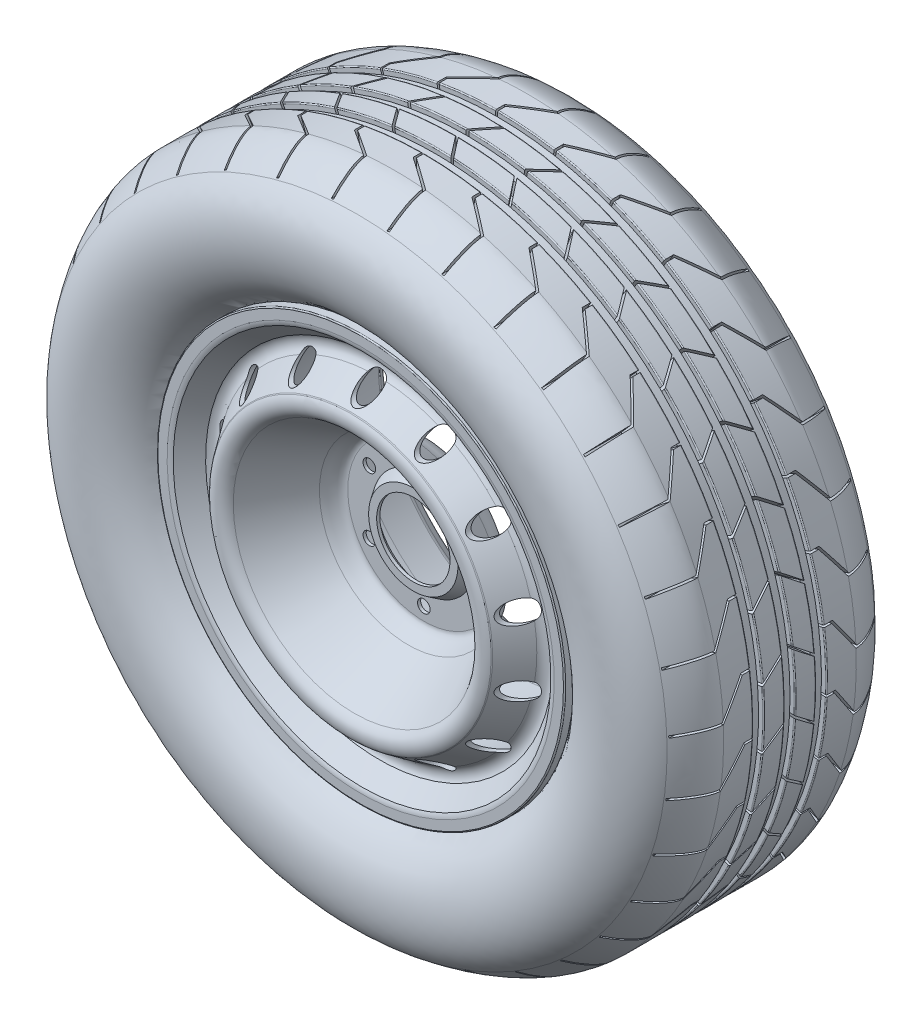
from build123d import *

# Parameters (mm, degrees)
SKETCH4_R          = 10
CUT_EXTRUDE1_DEPTH = 280
SKETCH5_R          = 6
CUT_EXTRUDE2_DEPTH = 308.751546457
SKETCH8_W          = 10
SKETCH8_H          = 5
FILLET1_R          = 1
CUT_EXTRUDE3_DEPTH = 25
CIRPATTERN1_COUNT  = 35


with BuildPart() as part:
    # Sketch3 → Revolve2 (revolve)
    with BuildSketch(Plane(origin=(0, 0, 0), x_dir=(0, 0, -1), z_dir=(1, 0, 0))):
        with BuildLine():
            Line((-205.976672895, 132.545710763), (-168.32873816, 158.905030976))
            Line((-168.32873816, 158.905030976), (-50.533527528, 160.605115441))
            Line((-50.533527528, 160.605115441), (-19.67682352, 162.242109346))
            ThreePointArc((-19.67682352, 162.242109346), (-17.988866809, 162.681997), (-16.502942556, 163.595631567))
            Line((-16.502942556, 163.595631567), (-8.613282192, 169.732034072))
            ThreePointArc((-8.613282192, 169.732034072), (-7.23504651, 171.163590491), (-6.367288364, 172.951293815))
            Line((-6.367288364, 172.951293815), (-3.257166694, 181.724352935))
            ThreePointArc((-3.257166694, 181.724352935), (-2.62535832, 183.407484304), (-2.478866017, 185.199313826))
            Line((-2.478866017, 185.199313826), (-2.478866017, 190.02316213))
            ThreePointArc((-2.478866017, 190.02316213), (-3.464560288, 194.56121075), (-8.002608909, 193.575516479))
            Line((-8.002608909, 193.575516479), (-15.84871123, 193.575516479))
            ThreePointArc((-15.84871123, 193.575516479), (-16.347620773, 193.357623724), (-16.565513529, 192.85871418))
            Line((-16.565513529, 192.85871418), (-16.565513529, 188.096364254))
            ThreePointArc((-16.565513529, 188.096364254), (-16.672768644, 187.147180592), (-17.066683828, 186.276959866))
            Line((-17.066683828, 186.276959866), (-21.032277405, 177.690694143))
            ThreePointArc((-21.032277405, 177.690694143), (-21.913333431, 176.327612765), (-23.041277725, 175.160568535))
            Line((-23.041277725, 175.160568535), (-29.905978286, 169.821356987))
            ThreePointArc((-29.905978286, 169.821356987), (-31.406523464, 168.93888179), (-33.134571829, 168.728531716))
            Line((-33.134571829, 168.728531716), (-60.542176562, 168.728531716))
            Line((-60.542176562, 168.728531716), (-164.636430634, 169.644050138))
            ThreePointArc((-164.636430634, 169.644050138), (-171.313601612, 170.559422201), (-177.229613663, 173.787938839))
            Line((-177.229613663, 173.787938839), (-180.613912, 175.971696747))
            Line((-180.613912, 175.971696747), (-187.299183614, 184.567045965))
            ThreePointArc((-187.299183614, 184.567045965), (-188.500602287, 186.514981874), (-188.97748407, 188.753384183))
            Line((-188.97748407, 188.753384183), (-188.97748407, 193.511188152))
            ThreePointArc((-188.97748407, 193.511188152), (-189.293281495, 194.175237477), (-189.95733082, 194.491034901))
            Line((-189.95733082, 194.491034901), (-197.443763886, 194.491034901))
            ThreePointArc((-197.443763886, 194.491034901), (-198.190119131, 194.145301882), (-198.53585215, 193.398946637))
            Line((-198.53585215, 193.398946637), (-198.53585215, 184.567045965))
            ThreePointArc((-198.53585215, 184.567045965), (-198.147923782, 182.240346175), (-197.247657756, 180.060084398))
            Line((-197.247657756, 180.060084398), (-180.613912, 165.772511518))
            ThreePointArc((-180.613912, 165.772511518), (-178.993638023, 158.574272361), (-182.937855027, 152.338641924))
            Line((-182.937855027, 152.338641924), (-207.697312521, 135.00322969))
            Line((-207.697312521, 135.00322969), (-208.408674764, 134.302232015))
            ThreePointArc((-208.408674764, 134.302232015), (-210.599766045, 124.053775031), (-204.517883943, 115.518995499))
            Line((-204.517883943, 115.518995499), (-153.01247642, 84.869794829))
            add(Edge.make_bspline(
                [(-153.01247642, 84.869794829), (-151.064119062, 83.710390438), (-144.265476161, 80.542437664), (-138.325, 76.29074716), (-138.325, 72.5)],
                knots=[0, 0, 0, 0, 0.479312715, 1, 1, 1, 1], degree=3))
            Line((-138.325, 72.5), (-138.325, 49.128999377))
            Line((-138.325, 49.128999377), (-148.325, 42.635891688))
            Line((-148.325, 42.635891688), (-148.325, 35))
            Line((-148.325, 35), (-145.325, 35))
            Line((-145.325, 35), (-145.325, 41.006892311))
            Line((-145.325, 41.006892311), (-135.325, 47.5))
            Line((-135.325, 47.5), (-135.325, 72.5))
            add(Edge.make_bspline(
                [(-154.188885966, 89.060819209), (-147.180223198, 84.890190882), (-141.057590791, 83.97066154), (-135.325, 76.308231088), (-135.325, 72.5)],
                knots=[0, 0, 0, 0, 0.64050498, 1, 1, 1, 1], degree=3))
            Line((-154.188885966, 89.060819209), (-202.98375688, 118.097067288))
            ThreePointArc((-202.98375688, 118.097067288), (-207.662127727, 124.662282313), (-205.976672895, 132.545710763))
        make_face()
    revolve(axis=Axis((0, 0, -0.000166179), (0, 0, 1)))

    # Sketch4 → Cut-Extrude1 (cut)
    with BuildSketch(Plane.XY.offset(258.53585215)):
        with Locations(Location((0, 147, 0), (0, 0, 269.999999996))):
            Circle(SKETCH4_R)
        with Locations(Location((63.78090965, 132.442423582, 0), (0, 0, 4.919230637))):
            Circle(SKETCH4_R)
        with Locations(Location((114.929227923, 91.653000873, 0), (0, 0, 339.204944922))):
            Circle(SKETCH4_R)
        with Locations(Location((143.314403091, 32.710577292, 0), (0, 0, 313.490659208))):
            Circle(SKETCH4_R)
        with Locations(Location((143.314403091, -32.710577292, 0), (0, 0, 46.50934073))):
            Circle(SKETCH4_R)
        with Locations(Location((114.929227923, -91.653000873, 0), (0, 0, 20.795055016))):
            Circle(SKETCH4_R)
        with Locations(Location((63.78090965, -132.442423582, 0), (0, 0, 355.080769302))):
            Circle(SKETCH4_R)
        with Locations(Location((0, -147, 0), (0, 0, 329.366483587))):
            Circle(SKETCH4_R)
        with Locations(Location((-63.78090965, -132.442423582, 0), (0, 0, 303.652197873))):
            Circle(SKETCH4_R)
        with Locations(Location((-114.929227923, -91.653000873, 0), (0, 0, 277.937912159))):
            Circle(SKETCH4_R)
        with Locations(Location((-143.314403091, -32.710577292, 0), (0, 0, 252.223626444))):
            Circle(SKETCH4_R)
        with Locations(Location((-143.314403091, 32.710577292, 0), (0, 0, 107.776373494))):
            Circle(SKETCH4_R)
        with Locations(Location((-114.929227923, 91.653000873, 0), (0, 0, 82.06208778))):
            Circle(SKETCH4_R)
        with Locations(Location((-63.78090965, 132.442423582, 0), (0, 0, 56.347802065))):
            Circle(SKETCH4_R)
    extrude(amount=-CUT_EXTRUDE1_DEPTH, mode=Mode.SUBTRACT)

    # Sketch5 → Cut-Extrude2 (cut, through all)
    with BuildSketch(Plane.XY.offset(138.325)):
        with Locations((0, 60)):
            Circle(SKETCH5_R)
        with Locations((51.961524227, 30)):
            Circle(SKETCH5_R)
        with Locations((51.961524227, -30)):
            Circle(SKETCH5_R)
        with Locations((0, -60)):
            Circle(SKETCH5_R)
        with Locations((-51.961524227, -30)):
            Circle(SKETCH5_R)
        with Locations((-51.961524227, 30)):
            Circle(SKETCH5_R)
    extrude(amount=-CUT_EXTRUDE2_DEPTH, mode=Mode.SUBTRACT)


with BuildPart() as body_2:
    # Sketch2 → Revolve3 (revolve)
    with BuildSketch(Plane(origin=(0, 0, 0), x_dir=(0, 0, -1), z_dir=(1, 0, 0))):
        with BuildLine():
            Line((-16.841841123, 188.497405413), (-16.841841123, 190.371286075))
            add(Edge.make_bspline(
                [(-16.841841123, 190.371286075), (-18.325078041, 194.651509706), (-11.218994202, 198.657808081), (18.038375738, 223.395196091), (23.581961715, 273.787913986), (-3.823701149, 295.563942392)],
                knots=[0, 0, 0, 0, 0.092593937, 0.175690741, 1, 1, 1, 1], degree=3))
            add(Edge.make_bspline(
                [(-3.823701149, 295.563942392), (-11.054342518, 301.602837614), (-28.724371157, 313.69), (-39.634002918, 313.69)],
                knots=[0, 0, 0, 0, 1, 1, 1, 1], degree=3))
            Line((-39.634002918, 313.69), (-166.105997082, 313.69))
            add(Edge.make_bspline(
                [(-201.916298851, 295.563942392), (-194.685657482, 301.602837614), (-177.015628843, 313.69), (-166.105997082, 313.69)],
                knots=[0, 0, 0, 0, 1, 1, 1, 1], degree=3))
            add(Edge.make_bspline(
                [(-188.898158877, 190.371286075), (-187.414921959, 194.651509706), (-194.521005798, 198.657808081), (-223.778375738, 223.395196091), (-229.321961715, 273.787913986), (-201.916298851, 295.563942392)],
                knots=[0, 0, 0, 0, 0.092593937, 0.175690741, 1, 1, 1, 1], degree=3))
            Line((-188.898158877, 190.371286075), (-188.898158877, 188.497405413))
            ThreePointArc((-188.898158877, 188.497405413), (-188.34793166, 187.119668546), (-187, 186.5))
            Line((-187, 186.5), (-172.410491082, 186.5))
            add(Edge.make_bspline(
                [(-194.359104699, 205.293895621), (-184.626225491, 203.680301423), (-171.070311407, 198.87547333), (-172.410491082, 186.5)],
                knots=[0, 0, 0, 0, 1, 1, 1, 1], degree=3))
            add(Edge.make_bspline(
                [(-102.87, 293.979526917), (-122.20862008, 293.979526917), (-146.808097308, 294.425225907), (-182.441022796, 290.361808714), (-213.553174942, 285.006701479), (-215.346225975, 259.172854777), (-214.359453345, 234.088416886), (-206.251754181, 212.706015592), (-194.359104699, 205.293895621)],
                knots=[0, 0, 0, 0, 0.276163159, 0.412599443, 0.589197595, 0.675863109, 0.783624344, 1, 1, 1, 1], degree=3))
            add(Edge.make_bspline(
                [(-102.87, 293.979526917), (-83.53137992, 293.979526917), (-58.931902692, 294.425225907), (-23.298977204, 290.361808714), (7.813174942, 285.006701479), (9.606225975, 259.172854777), (8.619453345, 234.088416886), (0.511754181, 212.706015592), (-11.380895301, 205.293895621)],
                knots=[0, 0, 0, 0, 0.276163159, 0.412599443, 0.589197595, 0.675863109, 0.783624344, 1, 1, 1, 1], degree=3))
            add(Edge.make_bspline(
                [(-11.380895301, 205.293895621), (-21.113774509, 203.680301423), (-34.669688593, 198.87547333), (-33.329508918, 186.5)],
                knots=[0, 0, 0, 0, 1, 1, 1, 1], degree=3))
            Line((-33.329508918, 186.5), (-18.74, 186.5))
            ThreePointArc((-18.74, 186.5), (-17.39206834, 187.119668546), (-16.841841123, 188.497405413))
        make_face()
    revolve(axis=Axis((0, 0, -0.000166179), (0, 0, 1)))

    # Sketch8 → Cut-Revolve1 (revolve, cut)
    with BuildSketch(Plane(origin=(0, 0, 0), x_dir=(0, 0, -1), z_dir=(1, 0, 0))):
        with Locations((-132.87, 311.19)):
            Rectangle(SKETCH8_W, SKETCH8_H)
        with Locations((-102.87, 311.19)):
            Rectangle(SKETCH8_W, SKETCH8_H)
        with Locations((-72.87, 311.19)):
            Rectangle(SKETCH8_W, SKETCH8_H)
    revolve(axis=Axis((0, 0, 168.32873816), (0, 0, -1)), mode=Mode.SUBTRACT)

    # Fillet1
    fillet1_edges = [body_2.edges().sort_by_distance(p)[0] for p in [
        (0, -313.69, 97.87),
        (0, -313.69, 107.87),
        (0, -313.69, 127.87),
        (0, -313.69, 137.87),
        (0, -313.69, 67.87),
        (0, -313.69, 77.87),
    ]]
    fillet(fillet1_edges, radius=FILLET1_R)

    # Sketch9 → Cut-Extrude3 (cut)
    with BuildSketch(Plane(origin=(0, 320, 0), x_dir=(1, 0, 0), z_dir=(0, 1, 0))):
        Polygon((0, -137.87), (0, -145.446335925), (29.59153403, -166.105997082), (29.59153403, -220.629597864), (27.59153403, -220.629597864), (27.59153403, -167.148878694), (-2, -146.489217536), (-2, -137.87), align=None)
        Polygon((-2, -67.87), (0, -67.87), (0, -60.293664075), (29.59153403, -39.634002918), (29.59153403, 14.889597864), (27.59153403, 14.889597864), (27.59153403, -38.591121306), (-2, -59.250782464), align=None)
        Polygon((0, -107.87), (15.388959689, -127.87), (17.912489122, -127.87), (2.523529434, -107.87), align=None)
        Polygon((15.388959689, -77.87), (17.912489122, -77.87), (2.523529434, -97.87), (0, -97.87), align=None)
    cut_extrude3 = extrude(amount=-CUT_EXTRUDE3_DEPTH, mode=Mode.SUBTRACT)

    # CirPattern1: Cut-Extrude3 ×35 about axis
    cirpattern1_axis = Axis((0, 0, 0), (0, 0, 1))
    for i in range(1, CIRPATTERN1_COUNT):
        add(cut_extrude3.rotate(cirpattern1_axis, i * 360 / CIRPATTERN1_COUNT), mode=Mode.SUBTRACT)


solid = Compound([part.part, body_2.part])
